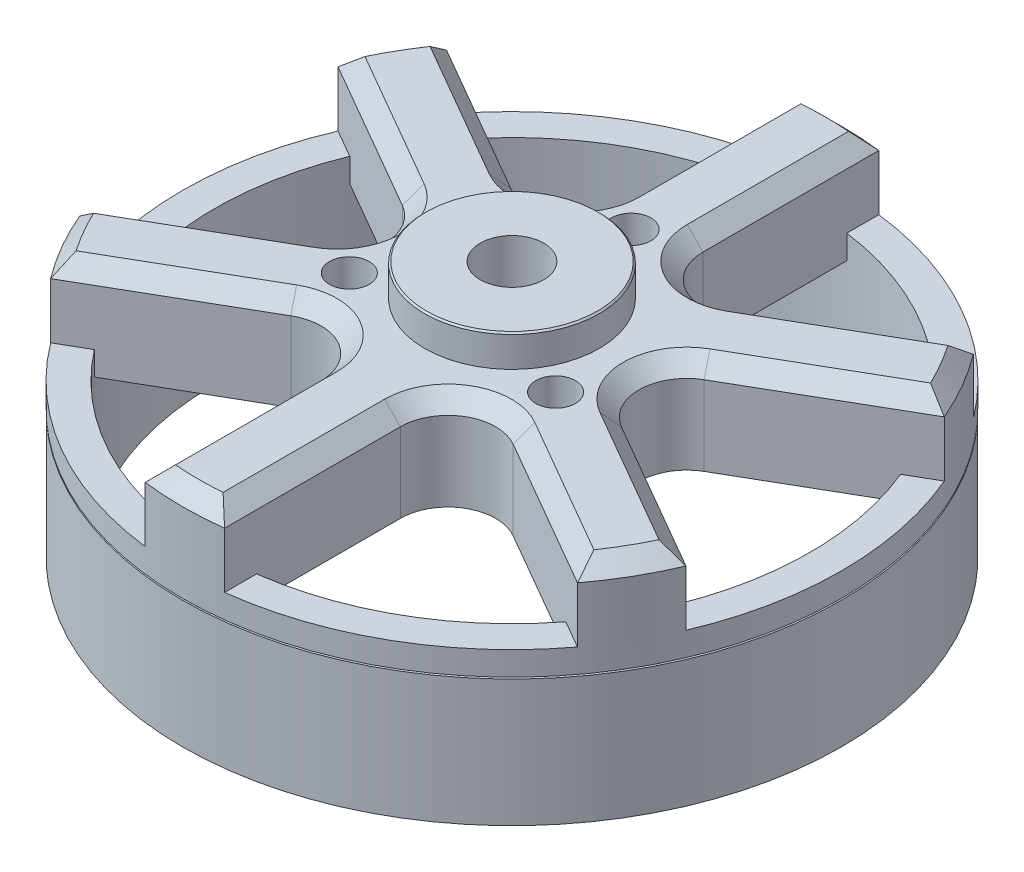
from build123d import *

# Parameters (mm, degrees)
SKETCH1_R           = 20.75
SKETCH1_R_2         = 18.75
BOSS_EXTRUDE1_DEPTH = 8
SKETCH2_R           = 20.4
SKETCH2_R_2         = 18.75
BOSS_EXTRUDE2_DEPTH = 0.1
SKETCH3_R           = 20.75
BOSS_EXTRUDE3_DEPTH = 6
SKETCH4_R           = 5.5
BOSS_EXTRUDE4_DEPTH = 2
SKETCH5_R           = 2
CUT_EXTRUDE1_DEPTH  = 22
SKETCH7_R           = 1.25
CUT_EXTRUDE2_DEPTH  = 10
CIRPATTERN1_COUNT   = 3
CUT_EXTRUDE3_START  = -4.5
CUT_EXTRUDE3_DEPTH  = 4.5
CUT_EXTRUDE4_START  = -4.5
CUT_EXTRUDE4_DEPTH  = 4.5
CHAMFER1_SIZE       = 1
CHAMFER2_SIZE       = 1
CHAMFER3_SIZE       = 0.1


with BuildPart() as part:
    # Sketch1 → Boss-Extrude1 (new body)
    with BuildSketch(Plane(origin=(0, 0, 0), x_dir=(1, 0, 0), z_dir=(0, 1, 0))):
        Circle(SKETCH1_R)
        Circle(SKETCH1_R_2, mode=Mode.SUBTRACT)
    extrude(amount=BOSS_EXTRUDE1_DEPTH)

    # Sketch2 → Boss-Extrude2 (add)
    with BuildSketch(Plane(origin=(0, 8, 0), x_dir=(1, 0, 0), z_dir=(0, 1, 0))):
        Circle(SKETCH2_R)
        Circle(SKETCH2_R_2, mode=Mode.SUBTRACT)
    extrude(amount=BOSS_EXTRUDE2_DEPTH)

    # Sketch3 → Boss-Extrude3 (add)
    with BuildSketch(Plane(origin=(0, 8.1, 0), x_dir=(1, 0, 0), z_dir=(0, 1, 0))):
        Circle(SKETCH3_R)
    extrude(amount=BOSS_EXTRUDE3_DEPTH)

    # Sketch4 → Boss-Extrude4 (add)
    with BuildSketch(Plane(origin=(0, 14.1, 0), x_dir=(1, 0, 0), z_dir=(0, 1, 0))):
        Circle(SKETCH4_R)
    extrude(amount=BOSS_EXTRUDE4_DEPTH)

    # Sketch5 → Cut-Extrude1 (cut)
    with BuildSketch(Plane(origin=(0, 16.1, 0), x_dir=(1, 0, 0), z_dir=(0, 1, 0))):
        Circle(SKETCH5_R)
    extrude(amount=-CUT_EXTRUDE1_DEPTH, mode=Mode.SUBTRACT)

    # Sketch7 → Cut-Extrude2 (cut)
    with BuildSketch(Plane(origin=(0, 14.1, 0), x_dir=(1, 0, 0), z_dir=(0, 1, 0))):
        with Locations((0, 7.5)):
            Circle(SKETCH7_R)
    cut_extrude2 = extrude(amount=-CUT_EXTRUDE2_DEPTH, mode=Mode.SUBTRACT)

    # CirPattern1: Cut-Extrude2 ×3 about axis
    cirpattern1_axis = Axis((0, 8, 0), (0, -1, 0))
    for i in range(1, CIRPATTERN1_COUNT):
        add(cut_extrude2.rotate(cirpattern1_axis, i * 360 / CIRPATTERN1_COUNT), mode=Mode.SUBTRACT)

    # Sketch8 → Cut-Extrude3 (cut)
    with BuildSketch(Plane(origin=(0, 14.1, 0), x_dir=(1, 0, 0), z_dir=(0, 1, 0)).offset(CUT_EXTRUDE3_START)):
        with BuildLine():
            Line((-16.589125, 12.464487), (-7, 6.928203))
            ThreePointArc((-7, 6.928203), (-4, 6.928203), (-2.5, 9.526279))
            Line((-2.5, 9.526279), (-2.5, 20.598847))
            ThreePointArc((-2.5, 20.598847), (-10.375, 17.970027), (-16.589125, 12.464487))
        make_face()
        with BuildLine():
            Line((-9.5, 2.598076), (-19.089125, 8.13436))
            ThreePointArc((-19.089125, 8.13436), (-20.75, 0), (-19.089125, -8.13436))
            Line((-19.089125, -8.13436), (-9.5, -2.598076))
            ThreePointArc((-9.5, -2.598076), (-8, 0), (-9.5, 2.598076))
        make_face()
        with BuildLine():
            ThreePointArc((16.589125, 12.464487), (10.375, 17.970027), (2.5, 20.598847))
            Line((2.5, 20.598847), (2.5, 9.526279))
            ThreePointArc((2.5, 9.526279), (4, 6.928203), (7, 6.928203))
            Line((7, 6.928203), (16.589125, 12.464487))
        make_face()
        with BuildLine():
            Line((-7, -6.928203), (-16.589125, -12.464487))
            ThreePointArc((-16.589125, -12.464487), (-10.375, -17.970027), (-2.5, -20.598847))
            Line((-2.5, -20.598847), (-2.5, -9.526279))
            ThreePointArc((-2.5, -9.526279), (-4, -6.928203), (-7, -6.928203))
        make_face()
        with BuildLine():
            ThreePointArc((19.089125, -8.13436), (20.75, 0), (19.089125, 8.13436))
            Line((19.089125, 8.13436), (9.5, 2.598076))
            ThreePointArc((9.5, 2.598076), (8, 0), (9.5, -2.598076))
            Line((9.5, -2.598076), (19.089125, -8.13436))
        make_face()
        with BuildLine():
            Line((2.5, -9.526279), (2.5, -20.598847))
            ThreePointArc((2.5, -20.598847), (10.375, -17.970027), (16.589125, -12.464487))
            Line((16.589125, -12.464487), (7, -6.928203))
            ThreePointArc((7, -6.928203), (4, -6.928203), (2.5, -9.526279))
        make_face()
    extrude(amount=CUT_EXTRUDE3_DEPTH, mode=Mode.SUBTRACT)

    # Sketch9 → Cut-Extrude4 (cut)
    with BuildSketch(Plane(origin=(0, 9.6, 0), x_dir=(1, 0, 0), z_dir=(0, 1, 0)).offset(CUT_EXTRUDE4_START)):
        with BuildLine():
            Line((-2.5, 18.582586), (-2.5, 9.526279))
            ThreePointArc((-2.5, 9.526279), (-4, 6.928203), (-7, 6.928203))
            Line((-7, 6.928203), (-14.842991, 11.456356))
            ThreePointArc((-14.842991, 11.456356), (-9.375, 16.237976), (-2.5, 18.582586))
        make_face()
        with BuildLine():
            Line((-2.5, -9.526279), (-2.5, -18.582586))
            ThreePointArc((-2.5, -18.582586), (-9.375, -16.237976), (-14.842991, -11.456356))
            Line((-14.842991, -11.456356), (-7, -6.928203))
            ThreePointArc((-7, -6.928203), (-4, -6.928203), (-2.5, -9.526279))
        make_face()
        with BuildLine():
            Line((14.842991, 11.456356), (7, 6.928203))
            ThreePointArc((7, 6.928203), (4, 6.928203), (2.5, 9.526279))
            Line((2.5, 9.526279), (2.5, 18.582586))
            ThreePointArc((2.5, 18.582586), (9.375, 16.237976), (14.842991, 11.456356))
        make_face()
        with BuildLine():
            Line((-17.342991, 7.126229), (-9.5, 2.598076))
            ThreePointArc((-9.5, 2.598076), (-8, 0), (-9.5, -2.598076))
            Line((-9.5, -2.598076), (-17.342991, -7.126229))
            ThreePointArc((-17.342991, -7.126229), (-18.75, 0), (-17.342991, 7.126229))
        make_face()
        with BuildLine():
            Line((9.5, -2.598076), (17.342991, -7.126229))
            ThreePointArc((17.342991, -7.126229), (18.75, 0), (17.342991, 7.126229))
            Line((17.342991, 7.126229), (9.5, 2.598076))
            ThreePointArc((9.5, 2.598076), (8, 0), (9.5, -2.598076))
        make_face()
        with BuildLine():
            Line((7, -6.928203), (14.842991, -11.456356))
            ThreePointArc((14.842991, -11.456356), (9.375, -16.237976), (2.5, -18.582586))
            Line((2.5, -18.582586), (2.5, -9.526279))
            ThreePointArc((2.5, -9.526279), (4, -6.928203), (7, -6.928203))
        make_face()
    extrude(amount=CUT_EXTRUDE4_DEPTH, mode=Mode.SUBTRACT)

    # Chamfer1
    chamfer1_edges = [part.edges().sort_by_distance(p)[0] for p in [
        (0, 14.1, -20.75),
        (-17.970027, 14.1, -10.375),
        (-17.970027, 14.1, 10.375),
        (0, 14.1, 20.75),
        (17.970027, 14.1, -10.375),
        (17.970027, 14.1, 10.375),
    ]]
    chamfer(chamfer1_edges, length=CHAMFER1_SIZE)

    # Chamfer2
    chamfer2_edges = [part.edges().sort_by_distance(p)[0] for p in [
        (2.5, 14.1, -14.558706),
        (-2.5, 14.1, -14.558706),
        (-4, 14.1, -6.928203),
        (-11.35821, 14.1, -9.444417),
        (-13.85821, 14.1, -5.11429),
        (-8, 14.1, 0),
        (-13.85821, 14.1, 5.11429),
        (-11.35821, 14.1, 9.444417),
        (-4, 14.1, 6.928203),
        (-2.5, 14.1, 14.558706),
        (4, 14.1, -6.928203),
        (11.35821, 14.1, -9.444417),
        (13.85821, 14.1, -5.11429),
        (8, 14.1, 0),
        (13.85821, 14.1, 5.11429),
        (11.35821, 14.1, 9.444417),
        (4, 14.1, 6.928203),
        (2.5, 14.1, 14.558706),
    ]]
    chamfer(chamfer2_edges, length=CHAMFER2_SIZE)

    # Chamfer3
    chamfer3_edges = [part.edges().sort_by_distance(p)[0] for p in [
        (-5.5, 16.1, 0),
    ]]
    chamfer(chamfer3_edges, length=CHAMFER3_SIZE)


solid = part.part
